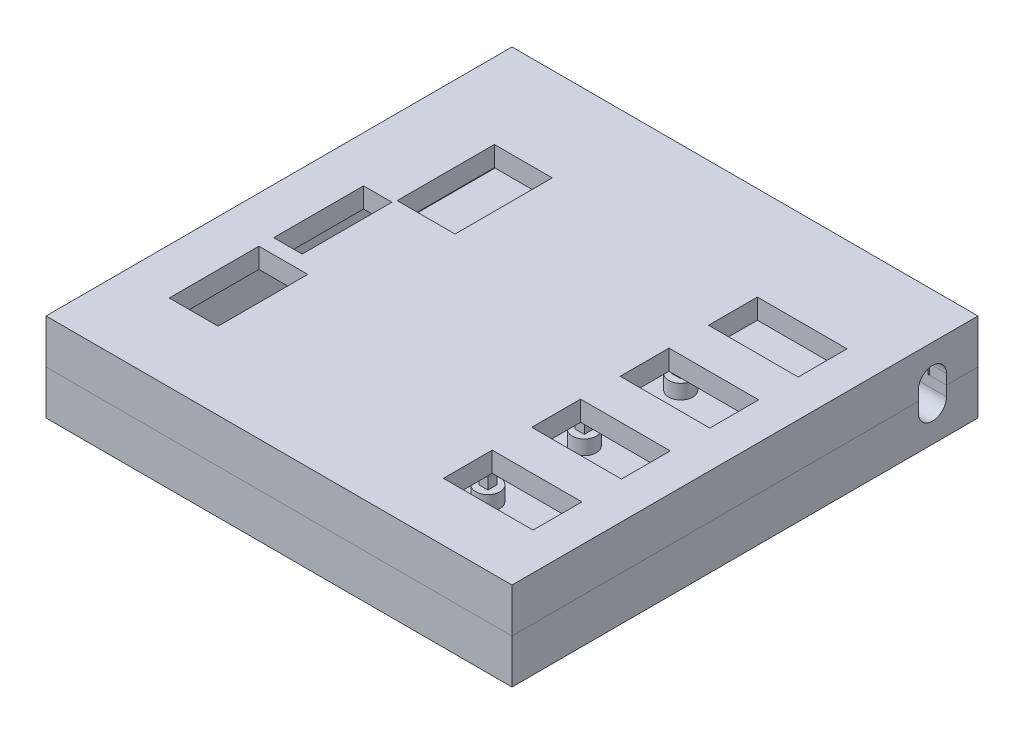
from build123d import *

# Parameters (mm, degrees)
EXTRUDE_1_DEPTH      = 5.5
EXTRUDE_1_DEPTH_BACK = 5.5
SKETCH_3_W           = 58
SKETCH_3_H           = 58
SHELL_START          = -25.5
SHELL_1_OUTLINE_W    = 6
SHELL_1_OUTLINE_H    = 51
SHELL_1_DEPTH        = 51
SKETCH_16_W          = 53.4
SKETCH_16_H          = 53.4
SKETCH_16_W_2        = 51
SKETCH_16_H_2        = 51
EXTRUDE_5_DEPTH      = 3
SKETCH_22_W          = 2.5
SKETCH_22_H          = 1.4
EXTRUDE_6_DEPTH      = 0.8
DRAFT_START          = -12.95
DRAFT_3_DEPTH        = 25.9
DRAFT_5_DEPTH        = 25.9
FILLET_2_R           = 0.2
OTHER_START          = -26.9
OTHER_1_DEPTH        = 53.8
OTHER_1_2_OUTLINE_W  = 0.2
OTHER_1_2_OUTLINE_H  = 50.6
OTHER_1_2_DEPTH      = 1.6
OTHER_START_2        = 25.3
OTHER_1_3_OUTLINE_W  = 0.2
OTHER_1_3_OUTLINE_H  = 50.6
OTHER_1_3_DEPTH      = 1.6
OTHER_START_3        = -13.15
OTHER_1_4_DEPTH      = 2.9
OTHER_START_4        = 10.25
OTHER_1_5_DEPTH      = 2.9
CUT_EXTRUDE_1_DEPTH  = 66.078798391
CUT_EXTRUDE_8_REACH  = 67.079
SKETCH_6_R           = 1.5
EXTRUDE_2_DEPTH      = 1.8
SKETCH_8_W           = 1.13137085
SKETCH_8_H           = 1.13137085
EXTRUDE_3_DEPTH      = 1.6
FILLET_1_R           = 0.3
SKETCH_23_W          = 6.08
SKETCH_23_H          = 11.16
SKETCH_23_W_2        = 3.54
SKETCH_23_H_2        = 11.18
SKETCH_23_W_3        = 7.2
SKETCH_23_H_3        = 12.1
SKETCH_23_W_4        = 11.16
SKETCH_23_H_4        = 6.08
CUT_EXTRUDE_9_DEPTH  = 2.5


# Read off the part's stored shape, not the designer's step: 抽壳1, 拔模3, 拔模5, 压凹1
with BuildPart() as part:
    # 草图3 → 凸台-拉伸1 (new, two sides: drawn at the far end of the back side and taken through both)
    with BuildSketch(Plane(origin=(0, 0, 0), x_dir=(1, 0, 0), z_dir=(0, 1, 0)).offset(-EXTRUDE_1_DEPTH_BACK)):
        Rectangle(SKETCH_3_W, SKETCH_3_H)
    extrude(amount=EXTRUDE_1_DEPTH + EXTRUDE_1_DEPTH_BACK)

    # 抽壳1 outline → 抽壳1 (cut)
    with BuildSketch(Plane.YZ.offset(SHELL_START)):
        Rectangle(SHELL_1_OUTLINE_W, SHELL_1_OUTLINE_H)
    extrude(amount=SHELL_1_DEPTH, mode=Mode.SUBTRACT)


with BuildPart() as body_2:
    # Split Bodies 1: the piece on the far side of the plane
    add(part.part)
    split(bisect_by=Plane.ZX, keep=Keep.BOTTOM)


with BuildPart() as part_1:
    add(part.part)

    # Split Bodies 1
    split(bisect_by=Plane.ZX, keep=Keep.TOP)

    # 压凹1 outline → 压凹1 (cut)
    with BuildSketch(Plane.YZ.offset(OTHER_START)):
        Polygon((0, 26.9), (0, -26.9), (3.2, -26.9), (3.2, -25.3), (3, -25.3), (3, 25.3), (3.2, 25.3), (3.2, 26.9), align=None)
    extrude(amount=OTHER_1_DEPTH, mode=Mode.SUBTRACT)

    # Other 1 2 outline → Other 1 2 (cut)
    with BuildSketch(Plane.YZ.offset(OTHER_START)):
        with Locations((3.1, 0)):
            Rectangle(OTHER_1_2_OUTLINE_W, OTHER_1_2_OUTLINE_H)
    extrude(amount=OTHER_1_2_DEPTH, mode=Mode.SUBTRACT)

    # Other 1 3 outline → Other 1 3 (cut)
    with BuildSketch(Plane.YZ.offset(OTHER_START_2)):
        with Locations((3.1, 0)):
            Rectangle(OTHER_1_3_OUTLINE_W, OTHER_1_3_OUTLINE_H)
    extrude(amount=OTHER_1_3_DEPTH, mode=Mode.SUBTRACT)

    # Other 1 4 outline → Other 1 4 (cut)
    with BuildSketch(Plane.YZ.offset(OTHER_START_3)):
        with BuildLine():
            Line((1.717157288, 27.4), (1.217157288, 26.9))
            Line((1.217157288, 26.9), (2.782842712, 26.9))
            Line((2.782842712, 26.9), (2.282842712, 27.4))
            ThreePointArc((2.282842712, 27.4), (2, 27.517157288), (1.717157288, 27.4))
        make_face()
        with BuildLine():
            Line((2.782842712, -26.9), (1.217157288, -26.9))
            Line((1.217157288, -26.9), (1.717157288, -27.4))
            ThreePointArc((1.717157288, -27.4), (2, -27.517157288), (2.282842712, -27.4))
            Line((2.282842712, -27.4), (2.782842712, -26.9))
        make_face()
    extrude(amount=OTHER_1_4_DEPTH, mode=Mode.SUBTRACT)

    # Other 1 5 outline → Other 1 5 (cut)
    with BuildSketch(Plane.YZ.offset(OTHER_START_4)):
        with BuildLine():
            Line((1.717157288, 27.4), (1.217157288, 26.9))
            Line((1.217157288, 26.9), (2.782842712, 26.9))
            Line((2.782842712, 26.9), (2.282842712, 27.4))
            ThreePointArc((2.282842712, 27.4), (2, 27.517157288), (1.717157288, 27.4))
        make_face()
        with BuildLine():
            Line((2.782842712, -26.9), (1.217157288, -26.9))
            Line((1.217157288, -26.9), (1.717157288, -27.4))
            ThreePointArc((1.717157288, -27.4), (2, -27.517157288), (2.282842712, -27.4))
            Line((2.282842712, -27.4), (2.782842712, -26.9))
        make_face()
    extrude(amount=OTHER_1_5_DEPTH, mode=Mode.SUBTRACT)

    # 草图7 → 切除-拉伸1 (cut, through all)
    with BuildSketch(Plane.ZY.offset(29)):
        with BuildLine():
            Line((-21.583, 1.25), (-21.583, -1.25))
            ThreePointArc((-21.583, -1.25), (-23.333, -3), (-25.083, -1.25))
            Line((-25.083, -1.25), (-25.083, 1.25))
            ThreePointArc((-25.083, 1.25), (-23.333, 3), (-21.583, 1.25))
        make_face()
    extrude(amount=-CUT_EXTRUDE_1_DEPTH, mode=Mode.SUBTRACT)

    # 草图23 → 切除-拉伸9 (cut)
    with BuildSketch(Plane(origin=(0, 5.5, 0), x_dir=(1, 0, 0), z_dir=(0, 1, 0))):
        with Locations((-20.23, -13.81)):
            Rectangle(SKETCH_23_W, SKETCH_23_H)
        with Locations((-21.5, -0.8)):
            Rectangle(SKETCH_23_W_2, SKETCH_23_H_2)
        with Locations((-15.98, 11.34)):
            Rectangle(SKETCH_23_W_3, SKETCH_23_H_3)
        with Locations((18.81, -18.73)):
            Rectangle(SKETCH_23_W_4, SKETCH_23_H_4)
        with Locations((18.81, -7.73)):
            Rectangle(SKETCH_23_W_4, SKETCH_23_H_4)
        with Locations((18.81, 3.27)):
            Rectangle(SKETCH_23_W_4, SKETCH_23_H_4)
        with Locations((18.81, 14.27)):
            Rectangle(SKETCH_23_W_4, SKETCH_23_H_4)
    extrude(amount=-CUT_EXTRUDE_9_DEPTH, mode=Mode.SUBTRACT)


with BuildPart() as body_3:
    # 草图16 → 凸台-拉伸5 (new body)
    with BuildSketch(Plane(origin=(0, 0, 0), x_dir=(1, 0, 0), z_dir=(0, 1, 0))):
        Rectangle(SKETCH_16_W, SKETCH_16_H)
        Rectangle(SKETCH_16_W_2, SKETCH_16_H_2, mode=Mode.SUBTRACT)
    extrude(amount=EXTRUDE_5_DEPTH)

    # 草图22 → 凸台-拉伸6 (add)
    with BuildSketch(Plane.XY.offset(26.7)):
        with Locations((-11.7, 2)):
            Rectangle(SKETCH_22_W, SKETCH_22_H)
        with Locations((11.7, 2)):
            Rectangle(SKETCH_22_W, SKETCH_22_H)
    extrude_6 = extrude(amount=EXTRUDE_6_DEPTH)

    # 镜向1: 凸台-拉伸6 across plane
    add(extrude_6.mirror(Plane.XY))

    # 拔模3 outline → 拔模3 (cut)
    with BuildSketch(Plane.YZ.offset(DRAFT_START)):
        Polygon((2, 27.4), (2.7, 26.7), (2.7, 27.5), (1.3, 27.5), (1.3, 26.7), align=None)
    extrude(amount=DRAFT_3_DEPTH, mode=Mode.SUBTRACT)

    # 拔模5 outline → 拔模5 (cut)
    with BuildSketch(Plane.YZ.offset(DRAFT_START)):
        Polygon((2, -27.4), (1.3, -26.7), (1.3, -27.5), (2.7, -27.5), (2.7, -26.7), align=None)
    extrude(amount=DRAFT_5_DEPTH, mode=Mode.SUBTRACT)

    # 圆角2
    fillet_2_edges = [body_3.edges().sort_by_distance(p)[0] for p in [
        (-11.7, 2, 27.4),
        (11.7, 2, 27.4),
        (11.7, 2, -27.4),
        (-11.7, 2, -27.4),
    ]]
    fillet(fillet_2_edges, radius=FILLET_2_R)

    # Combine 2: union body 2
    add(body_2.part)

    # 切除-拉伸8: up to this face of the body (flat: up to its plane)
    cut_extrude_8_end = Plane(body_3.part.faces().sort_by_distance((29, -2.75, 0))[0])
    # 草图21 → 切除-拉伸8 (cut, up to the picked face)
    with BuildSketch(Plane.ZY.offset(29), mode=Mode.PRIVATE) as cut_extrude_8_sk1:
        with BuildLine():
            Line((-25.083, 1.25), (-25.083, -1.25))
            ThreePointArc((-25.083, -1.25), (-23.333, -3), (-21.583, -1.25))
            Line((-21.583, -1.25), (-21.583, 1.25))
            Line((-21.583, 1.25), (-21.583, 3))
            Line((-21.583, 3), (-25.083, 3))
            Line((-25.083, 3), (-25.083, 1.25))
        make_face()
    cut_extrude_8_tool1 = split(extrude(cut_extrude_8_sk1.sketch, amount=-CUT_EXTRUDE_8_REACH, mode=Mode.PRIVATE), bisect_by=cut_extrude_8_end, keep=Keep.BOTH, mode=Mode.PRIVATE)
    add(cut_extrude_8_tool1.solids().sort_by(Axis((-29, 0.174214, -23.333), (1, 0, 0)))[0], mode=Mode.SUBTRACT)

    # 草图6 → 凸台-拉伸2 (add)
    with BuildSketch(Plane(origin=(0, -3, 0), x_dir=(1, 0, 0), z_dir=(0, 1, 0))):
        with Locations(Location((-15, -1, 0), (0, 0, 270))):
            Circle(SKETCH_6_R)
        with Locations(Location((10, -1, 0), (0, 0, 270))):
            Circle(SKETCH_6_R)
        with Locations(Location((-15, 11, 0), (0, 0, 270))):
            Circle(SKETCH_6_R)
        with Locations(Location((-15, -13, 0), (0, 0, 270))):
            Circle(SKETCH_6_R)
        with Locations(Location((10, -13, 0), (0, 0, 270))):
            Circle(SKETCH_6_R)
        with Locations(Location((10, 11, 0), (0, 0, 270))):
            Circle(SKETCH_6_R)
    extrude(amount=EXTRUDE_2_DEPTH)

    # 草图8 → 凸台-拉伸3 (add)
    with BuildSketch(Plane(origin=(0, -1.2, 0), x_dir=(1, 0, 0), z_dir=(0, 1, 0))):
        with Locations((10, -13)):
            Rectangle(SKETCH_8_W, SKETCH_8_H)
        with Locations((-15, -13)):
            Rectangle(SKETCH_8_W, SKETCH_8_H)
        with Locations((10, -1)):
            Rectangle(SKETCH_8_W, SKETCH_8_H)
        with Locations((10, 11)):
            Rectangle(SKETCH_8_W, SKETCH_8_H)
        with Locations((-15, -1)):
            Rectangle(SKETCH_8_W, SKETCH_8_H)
        with Locations((-15, 11)):
            Rectangle(SKETCH_8_W, SKETCH_8_H)
    extrude(amount=EXTRUDE_3_DEPTH)

    # 圆角1
    fillet_1_edges = [body_3.edges().sort_by_distance(p)[0] for p in [
        (-14.434314575, 0.4, 13),
        (-15, 0.4, 12.434314575),
        (-15.565685425, 0.4, 13),
        (-15, 0.4, 13.565685425),
        (10, 0.4, 12.434314575),
        (9.434314575, 0.4, 13),
        (10, 0.4, 13.565685425),
        (10.565685425, 0.4, 13),
        (10, 0.4, 0.434314575),
        (9.434314575, 0.4, 1),
        (10, 0.4, 1.565685425),
        (10.565685425, 0.4, 1),
        (10, 0.4, -11.565685425),
        (9.434314575, 0.4, -11),
        (10, 0.4, -10.434314575),
        (10.565685425, 0.4, -11),
        (-15, 0.4, 0.434314575),
        (-15.565685425, 0.4, 1),
        (-15, 0.4, 1.565685425),
        (-14.434314575, 0.4, 1),
        (-15, 0.4, -11.565685425),
        (-15.565685425, 0.4, -11),
        (-15, 0.4, -10.434314575),
        (-14.434314575, 0.4, -11),
    ]]
    fillet(fillet_1_edges, radius=FILLET_1_R)


solid = Compound([part_1.part, body_3.part])
